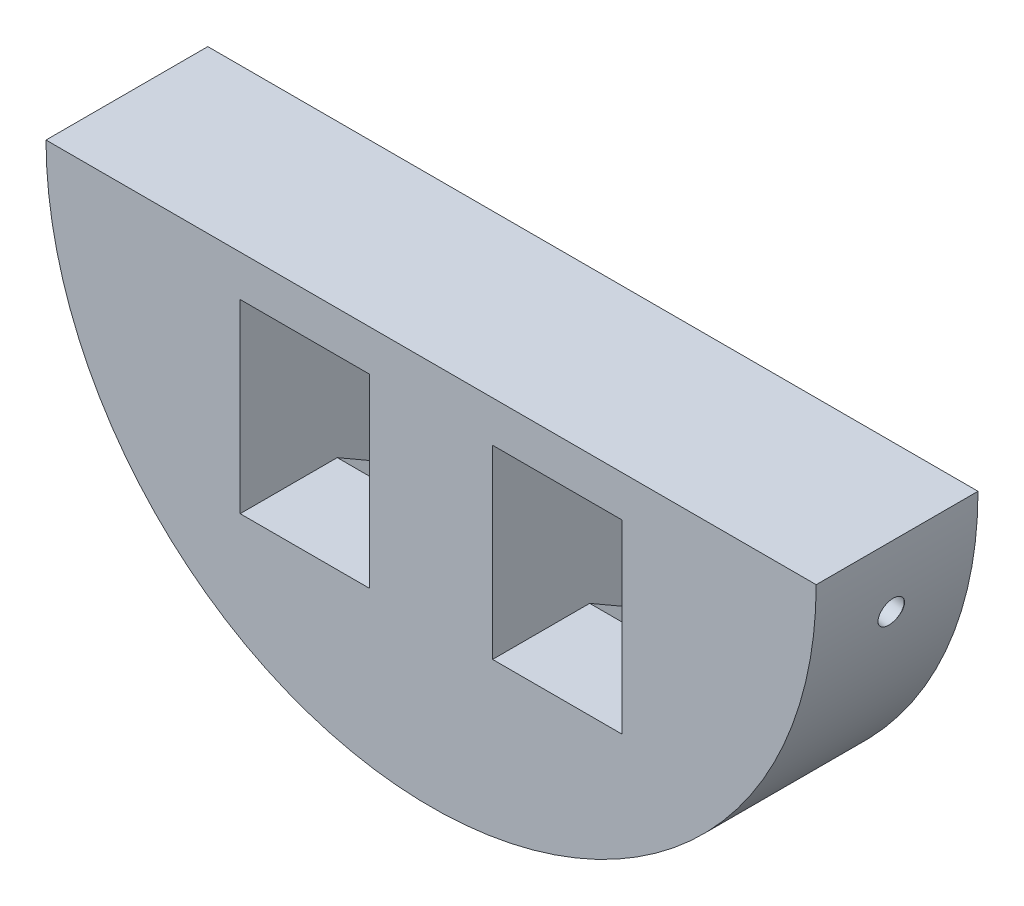
from build123d import *
from OCP.BRepFilletAPI import BRepFilletAPI_MakeChamfer

# Parameters (mm, degrees)
SKETCH1_W           = 20
SKETCH1_H           = 20
BOSS_EXTRUDE1_DEPTH = 25
CIRPATTERN1_COUNT   = 5
CIRPATTERN1_ANGLE   = 160
CHAMFER1_SIZE       = 15
CHAMFER1_SIZE2      = 8.660254038
CHAMFER2_SIZE       = 10
CHAMFER2_SIZE2      = 5.773502692


with BuildPart() as part:
    # Sketch1 → Boss-Extrude1 (new body)
    with BuildSketch(Plane.XY):
        with BuildLine():
            Line((-119, 0), (0, 0))
            ThreePointArc((0, 0), (-59.5, -59.5), (-119, 0))
        make_face()
        with Locations((-40, -25)):
            Rectangle(SKETCH1_W, SKETCH1_H, mode=Mode.SUBTRACT)
        with Locations((-79, -25)):
            Rectangle(SKETCH1_W, SKETCH1_H, mode=Mode.SUBTRACT)
    extrude(amount=BOSS_EXTRUDE1_DEPTH)

    # Sketch4 → Ø4.0mm Dowel Hole2 (revolve, cut)
    with BuildSketch(Plane(origin=(-0.903938696, -10.332066571, 12.5), x_dir=(0.1736481776669305, 0.9848077530122081, 0), z_dir=(0, 0, 1))):
        Polygon((0, 0), (0, 11.201721238), (2, 10), (2, 0.025), (2.025, 0), align=None)
    f_4_0mm_dowel_hole2 = revolve(axis=Axis((5.349590536, -11.434732499, 12.5), (-0.9848077530122081, 0.1736481776669305, 0)), mode=Mode.SUBTRACT)

    # CirPattern1: Ø4.0mm Dowel Hole2 ×5 about axis
    cirpattern1_axis = Axis((-59.5, 0, 0), (0, 0, -1))
    for i in range(1, CIRPATTERN1_COUNT):
        add(f_4_0mm_dowel_hole2.rotate(cirpattern1_axis, i * CIRPATTERN1_ANGLE / (CIRPATTERN1_COUNT - 1)), mode=Mode.SUBTRACT)

    # Chamfer1: one chamfer whose edges measure the first distance from different faces: ONE call of the kernel's chamfer builder (chamfer() names one face for all edges)
    chamfer1_edges_1 = [part.edges().sort_by_distance(p)[0] for p in [
        (-79, -15, 25),
    ]]
    chamfer1_side_1 = [part.faces().sort_by_distance(p)[0] for p in [
        (-79, -15, 12.5),
    ]]
    chamfer1_edges_2 = [part.edges().sort_by_distance(p)[0] for p in [
        (-40, -15, 25),
    ]]
    chamfer1_side_2 = [part.faces().sort_by_distance(p)[0] for p in [
        (-40, -15, 12.5),
    ]]
    chamfer1 = BRepFilletAPI_MakeChamfer(part.part.solid().wrapped)
    for e in chamfer1_edges_1:
        chamfer1.Add(CHAMFER1_SIZE, CHAMFER1_SIZE2, e.wrapped, chamfer1_side_1[0].wrapped)  # the first distance lies on this face
    for e in chamfer1_edges_2:
        chamfer1.Add(CHAMFER1_SIZE, CHAMFER1_SIZE2, e.wrapped, chamfer1_side_2[0].wrapped)  # the first distance lies on this face
    add(Compound.cast(chamfer1.Shape()), mode=Mode.REPLACE)

    # Chamfer2: one chamfer whose edges measure the first distance from different faces: ONE call of the kernel's chamfer builder (chamfer() names one face for all edges)
    chamfer2_edges_1 = [part.edges().sort_by_distance(p)[0] for p in [
        (-40, -35, 0),
    ]]
    chamfer2_side_1 = [part.faces().sort_by_distance(p)[0] for p in [
        (-40, -35, 12.5),
    ]]
    chamfer2_edges_2 = [part.edges().sort_by_distance(p)[0] for p in [
        (-79, -35, 0),
    ]]
    chamfer2_side_2 = [part.faces().sort_by_distance(p)[0] for p in [
        (-79, -35, 12.5),
    ]]
    chamfer2 = BRepFilletAPI_MakeChamfer(part.part.solid().wrapped)
    for e in chamfer2_edges_1:
        chamfer2.Add(CHAMFER2_SIZE, CHAMFER2_SIZE2, e.wrapped, chamfer2_side_1[0].wrapped)  # the first distance lies on this face
    for e in chamfer2_edges_2:
        chamfer2.Add(CHAMFER2_SIZE, CHAMFER2_SIZE2, e.wrapped, chamfer2_side_2[0].wrapped)  # the first distance lies on this face
    add(Compound.cast(chamfer2.Shape()), mode=Mode.REPLACE)


solid = part.part
